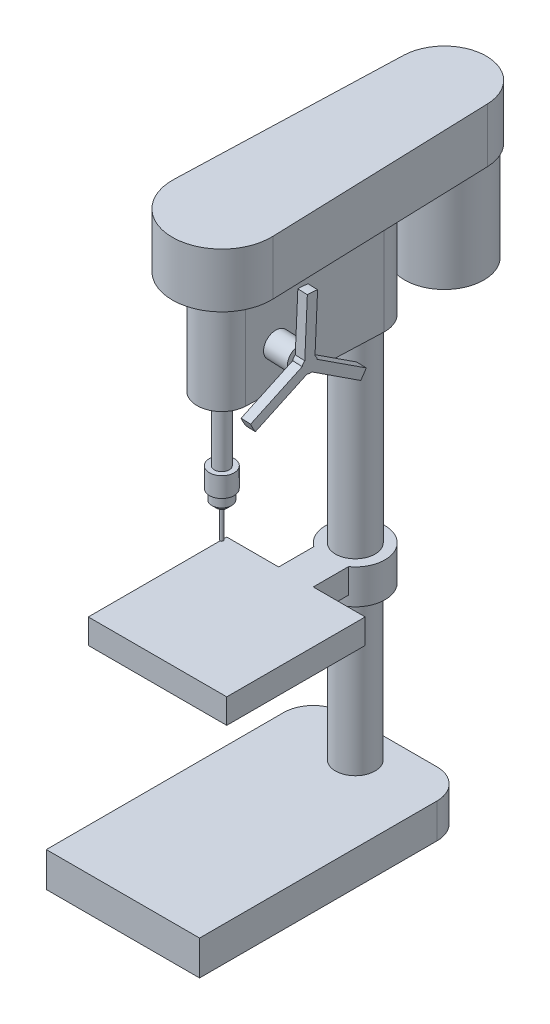
from build123d import *
from build123d.topology import SkipClean

# Parameters (mm, degrees)
SKETCH_1_W          = 310
SKETCH_1_H          = 540
EXTRUDE_1_DEPTH     = 70
FILLET_1_R          = 60
SKETCH_2_R          = 40
EXTRUDE_2_DEPTH     = 310
SKETCH_3_R          = 60
EXTRUDE_3_DEPTH     = 20
EXTRUDE_4_DEPTH     = 50
SKETCH_5_R          = 40
EXTRUDE_5_DEPTH     = 400
EXTRUDE_6_DEPTH     = 210
EXTRUDE_7_DEPTH     = 110
SKETCH_10_R         = 80
EXTRUDE_8_DEPTH     = 200
SKETCH_11_R         = 15
EXTRUDE_9_DEPTH     = 130
SKETCH_12_R         = 25
EXTRUDE_10_DEPTH    = 40
SKETCH_13_R         = 20
EXTRUDE_11_DEPTH    = 30
CHAMFER_1_SIZE      = 10
SKETCH_14_R         = 3.5
EXTRUDE_12_DEPTH    = 60
SKETCH_15_R         = 25
EXTRUDE_13_DEPTH    = 50
SKETCH_16_R         = 125
EXTRUDE_14_DEPTH    = 20
CUT_EXTRUDE_START   = -20
CUT_EXTRUDE_1_DEPTH = 20


with BuildPart() as part:
    # ｽｹｯﾁ1 → ﾎﾞｽ - 押し出し1 (new body)
    with BuildSketch(Plane(origin=(0, 0, 0), x_dir=(1, 0, 0), z_dir=(0, 1, 0))):
        with Locations((155, 270)):
            Rectangle(SKETCH_1_W, SKETCH_1_H)
    extrude(amount=EXTRUDE_1_DEPTH)

    # ﾌｨﾚｯﾄ1
    fillet_1_edges = [part.edges().sort_by_distance(p)[0] for p in [
        (0, 35, -540),
        (310, 35, -540),
    ]]
    fillet(fillet_1_edges, radius=FILLET_1_R)

    # ｽｹｯﾁ2 → ﾎﾞｽ - 押し出し2 (add)
    with BuildSketch(Plane(origin=(0, 70, 0), x_dir=(1, 0, 0), z_dir=(0, 1, 0))):
        with Locations((155, 470)):
            Circle(SKETCH_2_R)
    extrude(amount=EXTRUDE_2_DEPTH)

    # ｽｹｯﾁ3 → ﾎﾞｽ - 押し出し3 (add)
    with BuildSketch(Plane(origin=(0, 380, 0), x_dir=(1, 0, 0), z_dir=(0, 1, 0))):
        with Locations((155, 470)):
            Circle(SKETCH_3_R)
    extrude(amount=EXTRUDE_3_DEPTH)

    # ｽｹｯﾁ4 → ﾎﾞｽ - 押し出し4 (add)
    with SkipClean():  # the faces are left unmerged after this step: merging them gives an invalid solid
        with BuildSketch(Plane(origin=(0, 400, 0), x_dir=(1, 0, 0), z_dir=(0, 1, 0))):
            with BuildLine():
                Line((190, 350), (295, 350))
                Line((295, 350), (295, 70))
                Line((295, 70), (15, 70))
                Line((15, 70), (15, 350))
                Line((15, 350), (120, 350))
                Line((120, 350), (120, 421.266028))
                ThreePointArc((120, 421.266028), (155, 530), (190, 421.266028))
                Line((190, 421.266028), (190, 350))
            make_face()
        extrude(amount=EXTRUDE_4_DEPTH)

    # ｽｹｯﾁ5 → ﾎﾞｽ - 押し出し5 (add)
    with SkipClean():  # the faces are left unmerged after this step: merging them gives an invalid solid
        with BuildSketch(Plane(origin=(0, 450, 0), x_dir=(1, 0, 0), z_dir=(0, 1, 0))):
            with Locations((155, 470)):
                Circle(SKETCH_5_R)
        extrude(amount=EXTRUDE_5_DEPTH)

    # ｽｹｯﾁ8 → ﾎﾞｽ - 押し出し6 (add)
    with SkipClean():  # the faces are left unmerged after this step: merging them gives an invalid solid
        with BuildSketch(Plane(origin=(0, 850, 0), x_dir=(1, 0, 0), z_dir=(0, 1, 0))):
            with BuildLine():
                Line((95.041166, 467.777778), (105.034305, 198.148148))
                ThreePointArc((105.034305, 198.148148), (155, 150), (204.965695, 198.148148))
                Line((204.965695, 198.148148), (214.958834, 467.777778))
                ThreePointArc((214.958834, 467.777778), (155, 530), (95.041166, 467.777778))
            make_face()
        extrude(amount=EXTRUDE_6_DEPTH)

    # ｽｹｯﾁ9 → ﾎﾞｽ - 押し出し7 (add)
    with SkipClean():  # the faces are left unmerged after this step: merging them gives an invalid solid
        with BuildSketch(Plane(origin=(0, 1060, 0), x_dir=(1, 0, 0), z_dir=(0, 1, 0))):
            with BuildLine():
                Line((55.055571, 203.333333), (70.047235, 652.833333))
                ThreePointArc((70.047235, 652.833333), (155, 735), (239.952765, 652.833333))
                Line((239.952765, 652.833333), (254.944429, 203.333333))
                ThreePointArc((254.944429, 203.333333), (155, 100), (55.055571, 203.333333))
            make_face()
        extrude(amount=EXTRUDE_7_DEPTH)

    # ｽｹｯﾁ10 → ﾎﾞｽ - 押し出し8 (add)
    with SkipClean():  # the faces are left unmerged after this step: merging them gives an invalid solid
        with BuildSketch(Plane(origin=(0, 1060, 0), x_dir=(-1, 0, 0), z_dir=(0, -1, 0))):
            with Locations((-155, 650)):
                Circle(SKETCH_10_R)
        extrude(amount=EXTRUDE_8_DEPTH)

    # ｽｹｯﾁ11 → ﾎﾞｽ - 押し出し9 (add)
    with SkipClean():  # the faces are left unmerged after this step: merging them gives an invalid solid
        with BuildSketch(Plane(origin=(0, 850, 0), x_dir=(-1, 0, 0), z_dir=(0, -1, 0))):
            with Locations((-155, 200)):
                Circle(SKETCH_11_R)
        extrude(amount=EXTRUDE_9_DEPTH)

    # ｽｹｯﾁ12 → ﾎﾞｽ - 押し出し10 (add)
    with SkipClean():  # the faces are left unmerged after this step: merging them gives an invalid solid
        with BuildSketch(Plane(origin=(0, 720, 0), x_dir=(-1, 0, 0), z_dir=(0, -1, 0))):
            with Locations((-155, 200)):
                Circle(SKETCH_12_R)
        extrude(amount=EXTRUDE_10_DEPTH)

    # ｽｹｯﾁ13 → ﾎﾞｽ - 押し出し11 (add)
    with SkipClean():  # the faces are left unmerged after this step: merging them gives an invalid solid
        with BuildSketch(Plane(origin=(0, 680, 0), x_dir=(-1, 0, 0), z_dir=(0, -1, 0))):
            with Locations((-155, 200)):
                Circle(SKETCH_13_R)
        extrude(amount=EXTRUDE_11_DEPTH)

    # 面取り1
    chamfer_1_edges = [part.edges().sort_by_distance(p)[0] for p in [
        (175, 650, -200),
    ]]
    chamfer(chamfer_1_edges, length=CHAMFER_1_SIZE)

    # ｽｹｯﾁ14 → ﾎﾞｽ - 押し出し12 (add)
    with SkipClean():  # the faces are left unmerged after this step: merging them gives an invalid solid
        with BuildSketch(Plane(origin=(0, 650, 0), x_dir=(-1, 0, 0), z_dir=(0, -1, 0))):
            with Locations((-155, 200)):
                Circle(SKETCH_14_R)
        extrude(amount=EXTRUDE_12_DEPTH)

    # ｽｹｯﾁ15 → ﾎﾞｽ - 押し出し13 (add)
    with SkipClean():  # the faces are left unmerged after this step: merging them gives an invalid solid
        with BuildSketch(Plane(origin=(197.35075, 0, 7.314305), x_dir=(0.0370370370370371, 0, -0.9993138935727439), z_dir=(0.9993138935727439, 0, 0.0370370370370371))):
            with Locations((265.603519, 930)):
                Circle(SKETCH_15_R)
        extrude(amount=EXTRUDE_13_DEPTH)

    # ｽｹｯﾁ16 → ﾎﾞｽ - 押し出し14 (add)
    with SkipClean():  # the faces are left unmerged after this step: merging them gives an invalid solid
        with BuildSketch(Plane(origin=(247.316444, 0, 9.166157), x_dir=(0.03703703703703711, 0, -0.9993138935727439), z_dir=(0.9993138935727439, 0, 0.03703703703703711))):
            with Locations((265.603519, 930)):
                Circle(SKETCH_16_R)
        extrude(amount=EXTRUDE_14_DEPTH)

    # ｽｹｯﾁ17 → ｶｯﾄ - 押し出し1 (cut)
    with SkipClean():  # the faces are left unmerged after this step: merging them gives an invalid solid
        with BuildSketch(Plane(origin=(267.302722, 0, 9.906898), x_dir=(0.037037037037037125, 0, -0.9993138935727439), z_dir=(0.9993138935727439, 0, 0.037037037037037125)).offset(CUT_EXTRUDE_START)):
            with BuildLine():
                Line((150.427943, 881.424424), (251.071785, 933.718695))
                ThreePointArc((251.071785, 933.718695), (252.958803, 938.069148), (256.109578, 941.613142))
                Line((256.109578, 941.613142), (261.143332, 1054.920402))
                ThreePointArc((261.143332, 1054.920402), (160.230883, 997.242899), (150.427943, 881.424424))
            make_face()
            with BuildLine():
                Line((260.293214, 915.971434), (159.649372, 863.677163))
                ThreePointArc((159.649372, 863.677163), (260.055779, 805.12317), (365.258991, 854.542813))
                Line((365.258991, 854.542813), (269.648903, 915.555801))
                ThreePointArc((269.648903, 915.555801), (264.937791, 915.01478), (260.293214, 915.971434))
            make_face()
            with BuildLine():
                ThreePointArc((376.017854, 871.402435), (376.523896, 987.633931), (281.123625, 1054.032763))
                Line((281.123625, 1054.032763), (276.089871, 940.725504))
                ThreePointArc((276.089871, 940.725504), (278.913965, 936.916072), (280.407766, 932.415423))
                Line((280.407766, 932.415423), (376.017854, 871.402435))
            make_face()
        extrude(amount=CUT_EXTRUDE_1_DEPTH, mode=Mode.SUBTRACT)


solid = part.part
